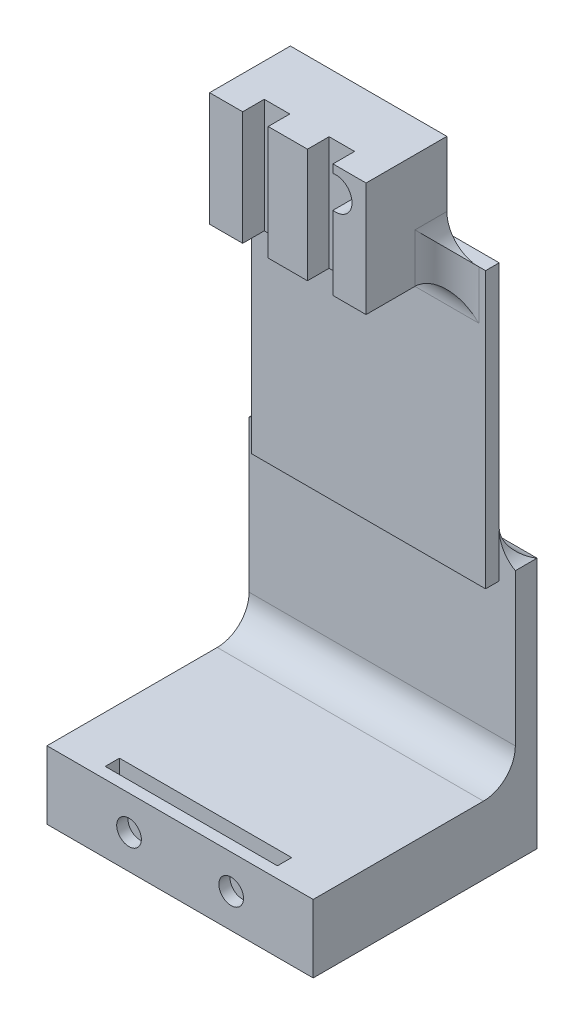
from build123d import *

# Parameters (mm, degrees)
SKETCH1_W           = 27.5
SKETCH1_H           = 32.4
BOSS_EXTRUDE1_DEPTH = 1.6
SKETCH2_W           = 18.4
SKETCH2_H           = 13.4
BOSS_EXTRUDE2_DEPTH = 9.5
SKETCH3_W           = 31.3
SKETCH3_H           = 19.46
BOSS_EXTRUDE3_DEPTH = 2.55
SKETCH6_W           = 3
SKETCH6_H           = 13.4
CUT_EXTRUDE1_DEPTH  = 2.54
CUT_EXTRUDE2_DEPTH  = 2.54
SKETCH9_W           = 31.3
SKETCH9_H           = 2.55
BOSS_EXTRUDE4_DEPTH = 2.132
SKETCH11_W          = 31.3
SKETCH11_H          = 26.3172
BOSS_EXTRUDE5_DEPTH = 8
SKETCH12_W          = 20.25
SKETCH12_H          = 1.678
CUT_EXTRUDE3_DEPTH  = 8
FILLET1_R           = 0.5
SKETCH13_R          = 1.45
CUT_EXTRUDE4_DEPTH  = 6
FILLET2_R           = 3.75
FILLET3_R           = 3.75
FILLET4_R           = 3.75
FILLET5_R           = 3.75
FILLET6_R           = 3.75
FILLET7_R           = 3.75
FILLET8_R           = 3.75
FILLET9_R           = 3.75


# Some blends are built 0.0001 mm under size
with BuildPart() as part:
    # Sketch1 → Boss-Extrude1 (new body)
    with BuildSketch(Plane.XY):
        with Locations((-13.75, 16.2)):
            Rectangle(SKETCH1_W, SKETCH1_H)
    extrude(amount=BOSS_EXTRUDE1_DEPTH)

    # Sketch2 → Boss-Extrude2 (add)
    with BuildSketch(Plane.XY.offset(1.6)):
        with Locations((-13.75, 37.1)):
            Rectangle(SKETCH2_W, SKETCH2_H)
    extrude(amount=BOSS_EXTRUDE2_DEPTH)

    # Sketch3 → Boss-Extrude3 (add)
    with BuildSketch(Plane(origin=(0, 0, 0), x_dir=(-1, 0, 0), z_dir=(0, 0, -1))):
        with Locations((13.75, -7.73)):
            Rectangle(SKETCH3_W, SKETCH3_H)
    extrude(amount=BOSS_EXTRUDE3_DEPTH)

    # Sketch6 → Cut-Extrude1 (cut)
    with BuildSketch(Plane.XY.offset(11.1)):
        with Locations((-17.56, 37.1)):
            Rectangle(SKETCH6_W, SKETCH6_H)
        with Locations((-9.94, 37.1)):
            Rectangle(SKETCH6_W, SKETCH6_H)
    extrude(amount=-CUT_EXTRUDE1_DEPTH, mode=Mode.SUBTRACT)

    # Sketch7 → Cut-Extrude2 (cut)
    with BuildSketch(Plane.XY.offset(11.1)):
        with BuildLine():
            Line((-8.44, 40.9552), (-8.44, 42.830691669))
            ThreePointArc((-8.44, 42.830691669), (-9.566358689, 42.178465098), (-10.011, 40.9552))
            Line((-10.011, 40.9552), (-8.44, 40.9552))
        make_face()
        with BuildLine():
            Line((-8.44, 39.079708331), (-8.44, 40.9552))
            Line((-8.44, 40.9552), (-10.011, 40.9552))
            ThreePointArc((-10.011, 40.9552), (-9.566358689, 39.731934902), (-8.44, 39.079708331))
        make_face()
        with BuildLine():
            ThreePointArc((-6.201, 40.9552), (-6.758961582, 42.302238418), (-8.106, 42.8602))
            Line((-8.106, 42.8602), (-8.106, 40.9552))
            Line((-8.106, 40.9552), (-6.201, 40.9552))
        make_face()
        with BuildLine():
            Line((-6.201, 40.9552), (-8.106, 40.9552))
            Line((-8.106, 40.9552), (-8.106, 39.0502))
            ThreePointArc((-8.106, 39.0502), (-6.758961582, 39.608161582), (-6.201, 40.9552))
        make_face()
        with BuildLine():
            Line((-8.106, 40.9552), (-8.106, 42.8602))
            ThreePointArc((-8.106, 42.8602), (-8.273650486, 42.852808578), (-8.44, 42.830691669))
            Line((-8.44, 42.830691669), (-8.44, 40.9552))
            Line((-8.44, 40.9552), (-8.106, 40.9552))
        make_face()
        with BuildLine():
            Line((-8.106, 39.0502), (-8.106, 40.9552))
            Line((-8.106, 40.9552), (-8.44, 40.9552))
            Line((-8.44, 40.9552), (-8.44, 39.079708331))
            ThreePointArc((-8.44, 39.079708331), (-8.273650486, 39.057591422), (-8.106, 39.0502))
        make_face()
    extrude(amount=-CUT_EXTRUDE2_DEPTH, mode=Mode.SUBTRACT)

    # Sketch9 → Boss-Extrude4 (add)
    with BuildSketch(Plane.XZ.offset(17.46)):
        with Locations((-13.75, -1.275)):
            Rectangle(SKETCH9_W, SKETCH9_H)
    extrude(amount=BOSS_EXTRUDE4_DEPTH)

    # Sketch11 → Boss-Extrude5 (add)
    with BuildSketch(Plane.XZ.offset(19.592)):
        with Locations((-13.75, 10.6086)):
            Rectangle(SKETCH11_W, SKETCH11_H)
    extrude(amount=BOSS_EXTRUDE5_DEPTH)

    # Sketch12 → Cut-Extrude3 (cut)
    with BuildSketch(Plane.XZ.offset(27.592)):
        with Locations((-13.75, 21.609)):
            Rectangle(SKETCH12_W, SKETCH12_H)
    extrude(amount=-CUT_EXTRUDE3_DEPTH, mode=Mode.SUBTRACT)

    # Fillet1
    fillet1_edges = [part.edges().sort_by_distance(p)[0] for p in [
        (-23.875, -27.592, 21.609),
        (-13.75, -27.592, 20.77),
        (-3.625, -27.592, 21.609),
        (-13.75, -27.592, 22.448),
    ]]
    fillet(fillet1_edges, radius=FILLET1_R)

    # Sketch13 → Cut-Extrude4 (cut)
    with BuildSketch(Plane.XY.offset(23.7672)):
        with Locations((-19.7549, -23.592)):
            Circle(SKETCH13_R)
        with Locations((-7.7451, -23.592)):
            Circle(SKETCH13_R)
    extrude(amount=-CUT_EXTRUDE4_DEPTH, mode=Mode.SUBTRACT)

    # Fillet2
    fillet2_edges = [part.edges().sort_by_distance(p)[0] for p in [
        (-13.75, -19.592, 0),
    ]]
    fillet(fillet2_edges, radius=FILLET2_R)

    # Fillet3
    # the kernel refuses this fillet: 3.75 mm, written as the material it adds along each edge
    with BuildSketch(Plane(origin=(0, 2, 0), x_dir=(0, 0, -1), z_dir=(-1, 0, 0))) as fillet3_piece_1:
        with BuildLine():
            CenterArc((3.75, -3.552815785), FILLET3_R, 108.662924885, 71.337075115)
            Line((0, -3.552815785), (0, 0))
            Line((0, 0), (2.55, 0))
        make_face()
    extrude(amount=27.5)

    # Fillet4
    fillet4_edges = [part.edges().sort_by_distance(p)[0] for p in [
        (-13.75, 30.4, 1.6),
    ]]
    fillet(fillet4_edges, radius=FILLET4_R)

    # Fillet5
    fillet5_edges = [part.edges().sort_by_distance(p)[0] for p in [
        (-22.95, 29.525, 1.6),
    ]]
    fillet(fillet5_edges, radius=FILLET5_R)

    # Fillet6
    fillet6_edges = [part.edges().sort_by_distance(p)[0] for p in [
        (-4.55, 29.525, 1.6),
    ]]
    fillet(fillet6_edges, radius=FILLET6_R)

    # Fillet7
    fillet7_edges = [part.edges().sort_by_distance(p)[0] for p in [
        (-22.95, 32.4, 3.475),
    ]]
    fillet(fillet7_edges, radius=FILLET7_R - 0.0001)  # a hair under: the kernel refuses the full size

    # Fillet8
    fillet8_edges = [part.edges().sort_by_distance(p)[0] for p in [
        (-4.55, 32.4, 3.475),
    ]]
    fillet(fillet8_edges, radius=FILLET8_R - 0.0001)  # a hair under: the kernel refuses the full size

    # Fillet9
    # the kernel refuses this fillet: 3.75 mm, written as the material it adds along each edge
    with BuildSketch(Plane(origin=(0, 2, 0), x_dir=(1, 0, 0), z_dir=(0, 0, -1))) as fillet9_piece_1_section:
        with BuildLine():
            CenterArc((3.75, -3.261901286), FILLET9_R, 119.559908379, 60.440091621)
            Line((0, -3.261901286), (0, 0))
            Line((0, 0), (1.9, 0))
        make_face()
    fillet9_piece_1 = extrude(amount=2.55, mode=Mode.PRIVATE)
    fillet9_piece_1 = fillet9_piece_1 - Plane(origin=(1.353199259, 5.552815785, -3.75), x_dir=(0, 0, -1), z_dir=(1, 0, 0)) * Cylinder(3.75, 19, mode=Mode.PRIVATE)
    add(fillet9_piece_1)
    with BuildSketch(Plane(origin=(-27.5, 2, 0), x_dir=(0, 1, 0), z_dir=(0, 0, -1))) as fillet9_piece_2_section:
        with BuildLine():
            CenterArc((3.261901286, -3.75), FILLET9_R, 90, 60.440091621)
            Line((0, -1.9), (0, 0))
            Line((0, 0), (3.261901286, 0))
        make_face()
    fillet9_piece_2 = extrude(amount=2.55, mode=Mode.PRIVATE)
    fillet9_piece_2 = fillet9_piece_2 - Plane(origin=(-28.00314891, 5.552815785, -3.75), x_dir=(0, 0, -1), z_dir=(1, 0, 0)) * Cylinder(3.75, 19, mode=Mode.PRIVATE)
    add(fillet9_piece_2)


solid = part.part
